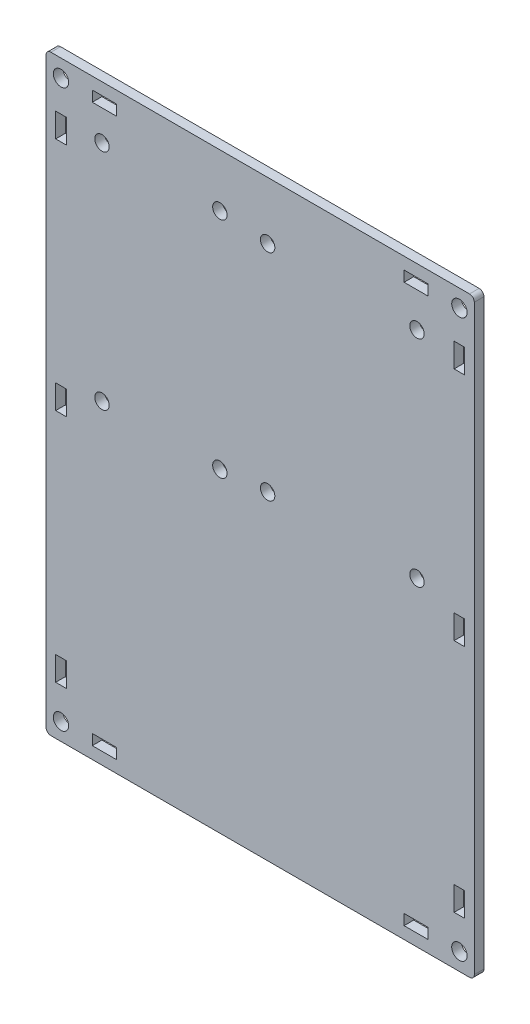
from build123d import *

# Parameters (mm, degrees)
SKETCH1_W           = 89
SKETCH1_H           = 123
SKETCH1_R           = 1.5
SKETCH1_R_2         = 1.6
SKETCH1_W_2         = 2.2
SKETCH1_H_2         = 5
SKETCH1_W_3         = 5
SKETCH1_H_3         = 2.2
BOSS_EXTRUDE1_DEPTH = 2
FILLET1_R           = 1


with BuildPart() as part:
    # Sketch1 → Boss-Extrude1 (new body)
    with BuildSketch(Plane.XY):
        Rectangle(SKETCH1_W, SKETCH1_H)
        with Locations((-32.88, 50.5)):
            Circle(SKETCH1_R, mode=Mode.SUBTRACT)
        with Locations((-8.38, 50.5)):
            Circle(SKETCH1_R, mode=Mode.SUBTRACT)
        with Locations((-32.88, 4)):
            Circle(SKETCH1_R, mode=Mode.SUBTRACT)
        with Locations((-8.38, 4)):
            Circle(SKETCH1_R, mode=Mode.SUBTRACT)
        with Locations((1.54, 49.58)):
            Circle(SKETCH1_R, mode=Mode.SUBTRACT)
        with Locations((32.58, 49.58)):
            Circle(SKETCH1_R, mode=Mode.SUBTRACT)
        with Locations((1.54, 4.88)):
            Circle(SKETCH1_R, mode=Mode.SUBTRACT)
        with Locations((32.58, 4.88)):
            Circle(SKETCH1_R, mode=Mode.SUBTRACT)
        with Locations((-41.4, 57.9)):
            Circle(SKETCH1_R_2, mode=Mode.SUBTRACT)
        with Locations((-41.4, -57.9)):
            Circle(SKETCH1_R_2, mode=Mode.SUBTRACT)
        with Locations((41.4, -57.9)):
            Circle(SKETCH1_R_2, mode=Mode.SUBTRACT)
        with Locations((41.4, 57.9)):
            Circle(SKETCH1_R_2, mode=Mode.SUBTRACT)
        with Locations((-41.4, 0)):
            Rectangle(SKETCH1_W_2, SKETCH1_H_2, mode=Mode.SUBTRACT)
        with Locations((-41.4, -48.9)):
            Rectangle(SKETCH1_W_2, SKETCH1_H_2, mode=Mode.SUBTRACT)
        with Locations((-41.4, 48.9)):
            Rectangle(SKETCH1_W_2, SKETCH1_H_2, mode=Mode.SUBTRACT)
        with Locations((41.4, 48.9)):
            Rectangle(SKETCH1_W_2, SKETCH1_H_2, mode=Mode.SUBTRACT)
        with Locations((41.4, -48.9)):
            Rectangle(SKETCH1_W_2, SKETCH1_H_2, mode=Mode.SUBTRACT)
        with Locations((41.4, 0)):
            Rectangle(SKETCH1_W_2, SKETCH1_H_2, mode=Mode.SUBTRACT)
        with Locations((32.4, 57.9)):
            Rectangle(SKETCH1_W_3, SKETCH1_H_3, mode=Mode.SUBTRACT)
        with Locations((-32.4, 57.9)):
            Rectangle(SKETCH1_W_3, SKETCH1_H_3, mode=Mode.SUBTRACT)
        with Locations((32.4, -57.9)):
            Rectangle(SKETCH1_W_3, SKETCH1_H_3, mode=Mode.SUBTRACT)
        with Locations((-32.4, -57.9)):
            Rectangle(SKETCH1_W_3, SKETCH1_H_3, mode=Mode.SUBTRACT)
    extrude(amount=BOSS_EXTRUDE1_DEPTH)

    # Fillet1
    fillet1_edges = [part.edges().sort_by_distance(p)[0] for p in [
        (44.5, -61.5, 1),
        (44.5, 61.5, 1),
        (-44.5, 61.5, 1),
        (-44.5, -61.5, 1),
    ]]
    fillet(fillet1_edges, radius=FILLET1_R)


solid = part.part
